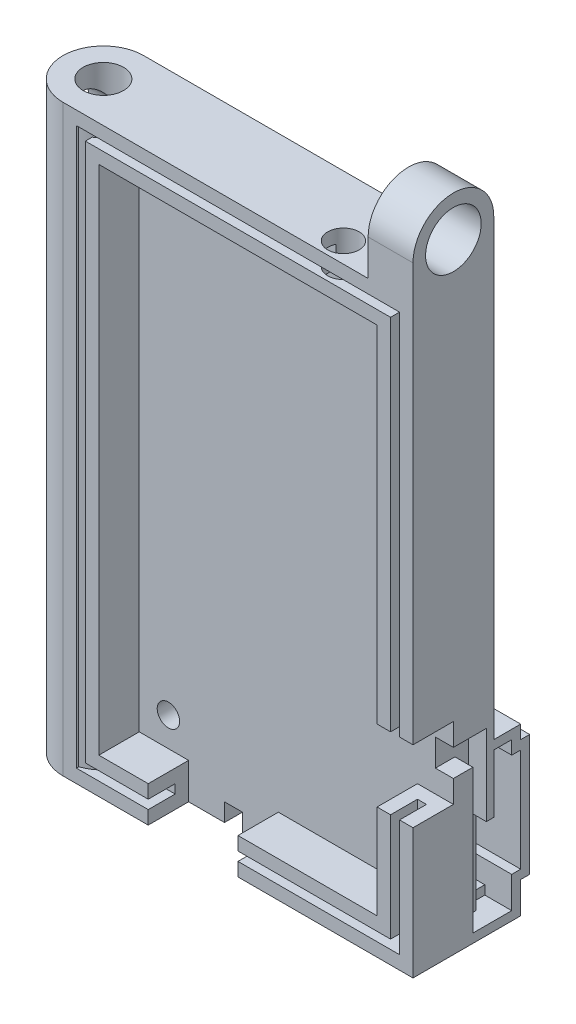
from build123d import *

# Parameters (mm, degrees)
SKETCH1_W                = 39
SKETCH1_H                = 65
BASE_DEPTH               = 4.5
SKETCH2_W                = 39
SKETCH2_H                = 65
SKETCH2_W_2              = 31
SKETCH2_H_2              = 57
WALLS_DEPTH              = 4.5
SKETCH3_W                = 10
SKETCH3_H                = 4.5
PWR_CONNECTOR_HOLE_DEPTH = 4
SKETCH4_W                = 4.5
SKETCH4_H                = 8
GPS_CONNECTOR_HOLE_DEPTH = 4
SKETCH5_R                = 1.25
MOUNTING_HOLES_DEPTH     = 4
GPS_MOUNT_DEPTH          = 3
SKETCH8_W                = 1
SKETCH8_H                = 1
GPS_RAILS_DEPTH          = 28
SKETCH9_W                = 1
SKETCH9_H                = 16.5
GPS_ROOF_DEPTH           = 14
SKETCH10_W               = 1
SKETCH10_H               = 1.5
SKETCH10_H_2             = 3.5
GPS_ROOF_2_DEPTH         = 17
SKETCH18_W               = 18
SKETCH18_H               = 1
CHIP_ROOF1_DEPTH         = 1
SKETCH19_W               = 18
SKETCH19_H               = 1
CHIP_ROOF2_DEPTH         = 12.5
SKETCH11_W               = 1
SKETCH11_H               = 3
PWR_CABLE_HOLDER1_DEPTH  = 3
PWR_CABLE_HOLDER2_DEPTH  = 2
GPS_CABLE_HOLDER_DEPTH   = 2
SKETCH14_W               = 36
SKETCH14_H               = 62
SKETCH14_W_2             = 34
SKETCH14_H_2             = 60
LID_MOUNT_DEPTH          = 3
SKETCH15_R               = 4.5
BALLON_MOUNT_DEPTH       = 65
SKETCH16_R               = 2.25
BALLOON_MOUNT_HOLE_DEPTH = 65
SKETCH17_W               = 2
SKETCH17_H               = 57
CORRECTION_DEPTH         = 4.5
SKETCH21_R               = 2.25
SAFETY_MOUNT_DEPTH       = 4.5
SKETCH22_W               = 5
SKETCH22_H               = 9
ANTENNA_MOUNT_BASE_DEPTH = 4
SKETCH23_R               = 4.5
ANTENNA_MOUNTING_DEPTH   = 5
SKETCH24_R               = 3.1
ANTENNA_MOUNT_HOLE_DEPTH = 5
SKETCH25_R               = 1.75
ANTENNA_CABLE_HOLE_DEPTH = 4


with BuildPart() as part:
    # Sketch1 → Base (new body)
    with BuildSketch(Plane.XY):
        with Locations((19.5, 32.5)):
            Rectangle(SKETCH1_W, SKETCH1_H)
    extrude(amount=BASE_DEPTH)

    # Sketch2 → Walls (add)
    with BuildSketch(Plane.XY.offset(4.5)):
        with Locations((19.5, 32.5)):
            Rectangle(SKETCH2_W, SKETCH2_H)
        with Locations((19.5, 32.5)):
            Rectangle(SKETCH2_W_2, SKETCH2_H_2, mode=Mode.SUBTRACT)
    extrude(amount=WALLS_DEPTH)

    # Sketch3 → PWR connector hole (cut)
    with BuildSketch(Plane(origin=(0, 4, 0), x_dir=(1, 0, 0), z_dir=(0, 1, 0))):
        with Locations((14.5, -6.75)):
            Rectangle(SKETCH3_W, SKETCH3_H)
    extrude(amount=-PWR_CONNECTOR_HOLE_DEPTH, mode=Mode.SUBTRACT)

    # Sketch4 → GPS connector hole (cut)
    with BuildSketch(Plane.ZY.offset(-35)):
        with Locations((6.75, 18.5)):
            Rectangle(SKETCH4_W, SKETCH4_H)
    extrude(amount=-GPS_CONNECTOR_HOLE_DEPTH, mode=Mode.SUBTRACT)

    # Sketch5 → Mounting holes (cut)
    with BuildSketch(Plane.XY.offset(4.5)):
        with Locations((7.25, 7.25)):
            Circle(SKETCH5_R)
        with Locations((31.75, 7.25)):
            Circle(SKETCH5_R)
        with Locations((7.25, 57.75)):
            Circle(SKETCH5_R)
        with Locations((31.75, 57.75)):
            Circle(SKETCH5_R)
    extrude(amount=-MOUNTING_HOLES_DEPTH, mode=Mode.SUBTRACT)

    # Sketch7 → GPS mount (add)
    with BuildSketch(Plane(origin=(0, 0, 0), x_dir=(-1, 0, 0), z_dir=(0, 0, -1))):
        Polygon((-8, 1), (-39, 1), (-39, 0), (-7, 0), (-7, 18.5), (-39, 18.5), (-39, 17.5), (-8, 17.5), align=None)
    extrude(amount=GPS_MOUNT_DEPTH)

    # Sketch8 → GPS rails (add)
    with BuildSketch(Plane(origin=(8, 0, 0), x_dir=(0, 0, -1), z_dir=(1, 0, 0))):
        with Locations((1.5, 17)):
            Rectangle(SKETCH8_W, SKETCH8_H)
        with Locations((1.5, 1.5)):
            Rectangle(SKETCH8_W, SKETCH8_H)
    extrude(amount=GPS_RAILS_DEPTH)

    # Sketch9 → GPS _roof (add)
    with BuildSketch(Plane(origin=(8, 0, 0), x_dir=(0, 0, -1), z_dir=(1, 0, 0))):
        with Locations((2.5, 9.25)):
            Rectangle(SKETCH9_W, SKETCH9_H)
    extrude(amount=GPS_ROOF_DEPTH)

    # Sketch10 → GPS _roof 2 (add)
    with BuildSketch(Plane(origin=(22, 0, 0), x_dir=(0, 0, -1), z_dir=(1, 0, 0))):
        with Locations((2.5, 16.75)):
            Rectangle(SKETCH10_W, SKETCH10_H)
        with Locations((2.5, 2.75)):
            Rectangle(SKETCH10_W, SKETCH10_H_2)
    extrude(amount=GPS_ROOF_2_DEPTH)

    # Sketch18 → Chip roof1 (add)
    with BuildSketch(Plane(origin=(0, 0, -3), x_dir=(-1, 0, 0), z_dir=(0, 0, -1))):
        with Locations((-30, 4)):
            Rectangle(SKETCH18_W, SKETCH18_H)
    extrude(amount=CHIP_ROOF1_DEPTH)

    # Sketch19 → Chip roof2 (add)
    with BuildSketch(Plane(origin=(0, 4.5, 0), x_dir=(1, 0, 0), z_dir=(0, 1, 0))):
        with Locations((30, 3.5)):
            Rectangle(SKETCH19_W, SKETCH19_H)
    extrude(amount=CHIP_ROOF2_DEPTH)

    # Sketch11 → PWR cable holder1 (add)
    with BuildSketch(Plane(origin=(0, 0, 0), x_dir=(-1, 0, 0), z_dir=(0, 0, -1))):
        Polygon((-5, 0), (-4, 0), (-4, 21.5), (-22, 21.5), (-22, 20.5), (-5, 20.5), align=None)
        with Locations((-27.5, 20)):
            Rectangle(SKETCH11_W, SKETCH11_H)
    extrude(amount=PWR_CABLE_HOLDER1_DEPTH)

    # Sketch12 → PWR cable holder2 (cut)
    with BuildSketch(Plane.XZ):
        Polygon((5, 2), (5, 0), (15.5, 0), (15.5, 4.5), (13.5, 4.5), (13.5, 2), align=None)
    extrude(amount=-PWR_CABLE_HOLDER2_DEPTH, mode=Mode.SUBTRACT)

    # Sketch13 → GPS cable holder (cut)
    with BuildSketch(Plane(origin=(39, 0, 0), x_dir=(0, 0, -1), z_dir=(1, 0, 0))):
        Polygon((-4.5, 20), (-4.5, 17), (-2.326586719, 17), (-2.326586719, 1), (0, 1), (0, 11), (-0.826586719, 11), (-0.826586719, 20), align=None)
    extrude(amount=-GPS_CABLE_HOLDER_DEPTH, mode=Mode.SUBTRACT)

    # Sketch14 → Lid mount (cut)
    with BuildSketch(Plane.XY.offset(9)):
        with Locations((19.5, 32.5)):
            Rectangle(SKETCH14_W, SKETCH14_H)
        with Locations((19.5, 32.5)):
            Rectangle(SKETCH14_W_2, SKETCH14_H_2, mode=Mode.SUBTRACT)
    extrude(amount=-LID_MOUNT_DEPTH, mode=Mode.SUBTRACT)

    # Sketch15 → Ballon mount (add)
    with BuildSketch(Plane.XZ):
        with Locations((0, 4.5)):
            Circle(SKETCH15_R)
    extrude(amount=-BALLON_MOUNT_DEPTH)

    # Sketch16 → Balloon mount hole (cut)
    with BuildSketch(Plane.XZ):
        with Locations((0, 4.5)):
            Circle(SKETCH16_R)
    extrude(amount=-BALLOON_MOUNT_HOLE_DEPTH, mode=Mode.SUBTRACT)

    # Sketch17 → Correction (cut)
    with BuildSketch(Plane.XY.offset(9)):
        with Locations((5, 32.5)):
            Rectangle(SKETCH17_W, SKETCH17_H)
    extrude(amount=-CORRECTION_DEPTH, mode=Mode.SUBTRACT)

    # Sketch21 → Safety mount (cut)
    with BuildSketch(Plane.ZY.offset(4.5)):
        with Locations((4.5, 4.5)):
            Circle(SKETCH21_R)
        with Locations((4.5, 60.5)):
            Circle(SKETCH21_R)
    extrude(amount=-SAFETY_MOUNT_DEPTH, mode=Mode.SUBTRACT)

    # Sketch22 → Antenna mount base (add)
    with BuildSketch(Plane(origin=(0, 65, 0), x_dir=(1, 0, 0), z_dir=(0, 1, 0))):
        with Locations((36.5, -4.5)):
            Rectangle(SKETCH22_W, SKETCH22_H)
    extrude(amount=ANTENNA_MOUNT_BASE_DEPTH)

    # Sketch23 → Antenna mounting (add)
    with BuildSketch(Plane(origin=(39, 0, 0), x_dir=(0, 0, -1), z_dir=(1, 0, 0))):
        with Locations((-4.5, 69)):
            Circle(SKETCH23_R)
    extrude(amount=-ANTENNA_MOUNTING_DEPTH)

    # Sketch24 → Antenna mount hole (cut)
    with BuildSketch(Plane(origin=(39, 0, 0), x_dir=(0, 0, -1), z_dir=(1, 0, 0))):
        with Locations((-4.5, 69)):
            Circle(SKETCH24_R)
    extrude(amount=-ANTENNA_MOUNT_HOLE_DEPTH, mode=Mode.SUBTRACT)

    # Sketch25 → Antenna cable hole (cut)
    with BuildSketch(Plane(origin=(0, 65, 0), x_dir=(1, 0, 0), z_dir=(0, 1, 0))):
        with Locations((29, -6.75)):
            Circle(SKETCH25_R)
    extrude(amount=-ANTENNA_CABLE_HOLE_DEPTH, mode=Mode.SUBTRACT)


solid = part.part
